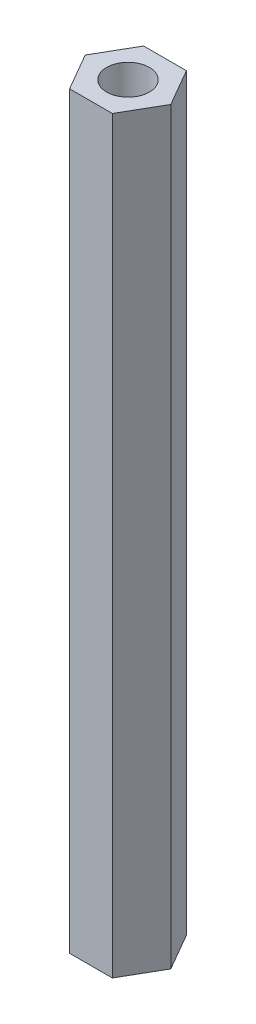
from build123d import *

# Parameters (mm, degrees)
SKETCH_1_R      = 2
EXTRUDE_1_DEPTH = 70


with BuildPart() as part:
    # 草图1 → 凸台-拉伸1 (new body)
    with BuildSketch(Plane(origin=(0, 0, 0), x_dir=(1, 0, 0), z_dir=(0, 1, 0))):
        Polygon((-1.90176803, 4.329567776), (-3.90176803, 0.865466161), (-1.90176803, -2.598635455), (2.09823197, -2.598635455), (4.09823197, 0.865466161), (2.09823197, 4.329567776), align=None)
        with Locations((0.09823197, 0.865466161)):
            Circle(SKETCH_1_R, mode=Mode.SUBTRACT)
    extrude(amount=EXTRUDE_1_DEPTH)


solid = part.part
